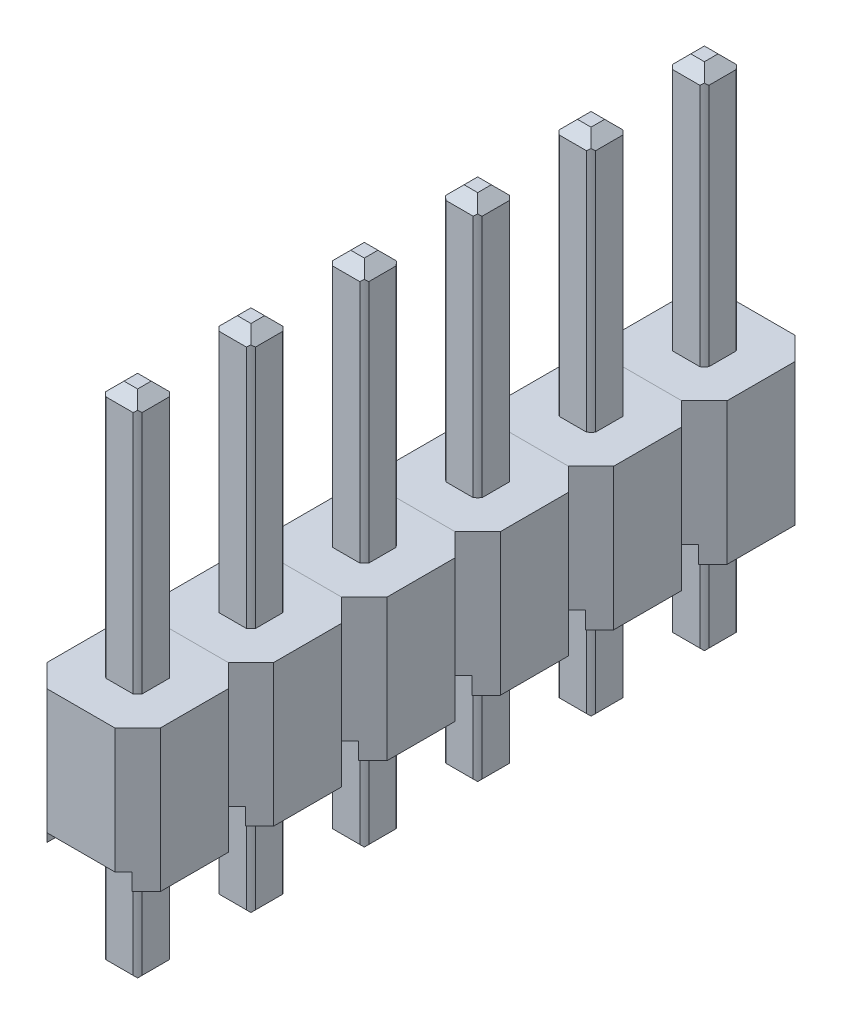
from build123d import *

# Parameters (mm, degrees)
SKETCH3_W                = 2
SKETCH3_H                = 2
BOSS_EXTRUDE3_DEPTH      = 2.5
SKETCH4_W                = 1.5
SKETCH4_H                = 0.3
CUT_EXTRUDE1_DEPTH       = 4.354101966
CHAMFER1_SIZE            = 0.4
BOSS_EXTRUDE4_DEPTH      = 7
BOSS_EXTRUDE4_DEPTH_BACK = 2
CHAMFER2_SIZE            = 0.2
LPATTERN1_COUNT          = 6
LPATTERN1_PITCH          = 2


with BuildPart() as part:
    # Sketch3 → Boss-Extrude3 (new body)
    with BuildSketch(Plane(origin=(0, 0, 0), x_dir=(1, 0, 0), z_dir=(0, 1, 0))):
        Rectangle(SKETCH3_W, SKETCH3_H)
    extrude(amount=BOSS_EXTRUDE3_DEPTH)

    # Sketch4 → Cut-Extrude1 (cut, through all)
    with BuildSketch(Plane.XY.offset(1)):
        with Locations((0, 0.15)):
            Rectangle(SKETCH4_W, SKETCH4_H)
    extrude(amount=-CUT_EXTRUDE1_DEPTH, mode=Mode.SUBTRACT)

    # Chamfer1
    chamfer1_edges = [part.edges().sort_by_distance(p)[0] for p in [
        (-1, 1.25, 1),
        (-1, 1.25, -1),
        (1, 1.25, -1),
        (1, 1.25, 1),
    ]]
    chamfer(chamfer1_edges, length=CHAMFER1_SIZE)

    # Sketch5 → Boss-Extrude4 (add, two sides: drawn at the far end of the back side and taken through both)
    with BuildSketch(Plane(origin=(0, 0, 0), x_dir=(1, 0, 0), z_dir=(0, 1, 0)).offset(-BOSS_EXTRUDE4_DEPTH_BACK)):
        with BuildLine():
            Line((-0.24, -0.32), (0.24, -0.32))
            ThreePointArc((0.24, -0.32), (0.282842712, -0.282842712), (0.32, -0.24))
            Line((0.32, -0.24), (0.32, 0.24))
            ThreePointArc((0.32, 0.24), (0.282842712, 0.282842712), (0.24, 0.32))
            Line((0.24, 0.32), (-0.24, 0.32))
            ThreePointArc((-0.24, 0.32), (-0.282842712, 0.282842712), (-0.32, 0.24))
            Line((-0.32, 0.24), (-0.32, -0.24))
            ThreePointArc((-0.32, -0.24), (-0.282842712, -0.282842712), (-0.24, -0.32))
        make_face()
    extrude(amount=BOSS_EXTRUDE4_DEPTH + BOSS_EXTRUDE4_DEPTH_BACK)

    # Chamfer2
    # the kernel refuses this chamfer: 0.2 mm, written as the material it takes off along each edge
    with BuildSketch(Plane(origin=(0.32, -2, 0.754336598), x_dir=(0.027495876610586285, 0.9996219169112968, 0), z_dir=(0, 0, -1)), Plane(origin=(0.754336598, -2, -0.32), x_dir=(0, 0.9996219169112968, -0.027495876610586285), z_dir=(-1, 0, 0)), Plane(origin=(-0.32, -2, -0.754336598), x_dir=(-0.027495876610586285, 0.9996219169112968, 0), z_dir=(0, 0, 1)), Plane(origin=(-0.754336598, -2, 0.32), x_dir=(0, 0.9996219169112968, 0.027495876610586285), z_dir=(1, 0, 0))) as chamfer2_piece_1:
        Polygon((CHAMFER2_SIZE * 0.999621916911, -CHAMFER2_SIZE * 0.0274958766106), (-CHAMFER2_SIZE * 0.0274958766106, -CHAMFER2_SIZE * 0.999621916911), (0, 0), align=None)
    extrude(amount=1.508673195, mode=Mode.SUBTRACT)
    with BuildSketch(Plane(origin=(-0.754336598, 7, 0.32), x_dir=(0, -0.9996219169112968, 0.027495876610586226), z_dir=(1, 0, 0)), Plane(origin=(-0.32, 7, -0.754336598), x_dir=(-0.027495876610586223, -0.9996219169112966, 0), z_dir=(0, 0, 1)), Plane(origin=(0.754336598, 7, -0.32), x_dir=(0, -0.9996219169112968, -0.027495876610586226), z_dir=(-1, 0, 0)), Plane(origin=(0.32, 7, 0.754336598), x_dir=(0.027495876610586223, -0.9996219169112966, 0), z_dir=(0, 0, -1))) as chamfer2_piece_2:
        Polygon((CHAMFER2_SIZE * 0.999621916911, CHAMFER2_SIZE * 0.0274958766106), (-CHAMFER2_SIZE * 0.0274958766106, CHAMFER2_SIZE * 0.999621916911), (0, 0), align=None)
    extrude(amount=1.508673195, mode=Mode.SUBTRACT)


with BuildPart() as lpattern1_1:
    # LPattern1: pattern copy
    add(part.part.moved(Location(Vector(0, 0, -1) * (1 * LPATTERN1_PITCH))))


with BuildPart() as lpattern1_2:
    # LPattern1: pattern copy
    add(part.part.moved(Location(Vector(0, 0, -1) * (2 * LPATTERN1_PITCH))))


with BuildPart() as lpattern1_3:
    # LPattern1: pattern copy
    add(part.part.moved(Location(Vector(0, 0, -1) * (3 * LPATTERN1_PITCH))))


with BuildPart() as lpattern1_4:
    # LPattern1: pattern copy
    add(part.part.moved(Location(Vector(0, 0, -1) * (4 * LPATTERN1_PITCH))))


with BuildPart() as lpattern1_5:
    # LPattern1: pattern copy
    add(part.part.moved(Location(Vector(0, 0, -1) * (5 * LPATTERN1_PITCH))))


solid = Compound([part.part, lpattern1_1.part, lpattern1_2.part, lpattern1_3.part, lpattern1_4.part, lpattern1_5.part])
